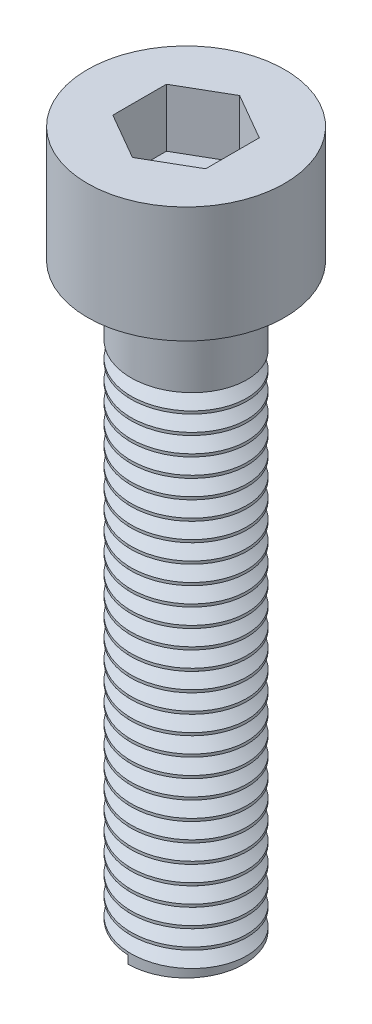
from build123d import *

# Parameters (mm, degrees)
SK_CABEZA_R         = 4.25
CABEZA_DEPTH        = 5
CANA_START          = -25
SK_CANA_R           = 2.5
CANA_DEPTH          = 25
HUECO_ALLEN_DEPTH   = 2.5
ROSCA_M5X0_8_PITCH  = 0.8
ROSCA_M5X0_8_HEIGHT = 22
ROSCA_M5X0_8_RADIUS = 2.5


with BuildPart() as part:
    # Sk_Cabeza → Cabeza (new body)
    with BuildSketch(Plane(origin=(0, 0, 0), x_dir=(1, 0, 0), z_dir=(0, 1, 0))):
        Circle(SK_CABEZA_R)
    extrude(amount=CABEZA_DEPTH)

    # Sk_Cana → Cana (add)
    with BuildSketch(Plane(origin=(0, 0, 0), x_dir=(1, 0, 0), z_dir=(0, 1, 0)).offset(CANA_START)):
        Circle(SK_CANA_R)
    extrude(amount=CANA_DEPTH)

    # Sk_Hueco_Allen → Hueco_Allen (cut)
    with BuildSketch(Plane(origin=(0, 5, 0), x_dir=(1, 0, 0), z_dir=(0, 1, 0))):
        Polygon((2, -1.154700538), (0, -2.309401077), (-2, -1.154700538), (-2, 1.154700538), (0, 2.309401077), (2, 1.154700538), align=None)
    extrude(amount=-HUECO_ALLEN_DEPTH, mode=Mode.SUBTRACT)

    # Rosca_M5x0,8: sweep along a helix
    with BuildLine() as rosca_m5x0_8_path:
        Helix(ROSCA_M5X0_8_PITCH, ROSCA_M5X0_8_HEIGHT, ROSCA_M5X0_8_RADIUS, center=(0, -25, 0), direction=(0, 1, 0), lefthand=True)
    # Sk_Perfil_rosca → Rosca_M5x0,8 (sweep, cut)
    with BuildSketch(Plane(origin=(0, 0, 0), x_dir=(0, 0, -1), z_dir=(1, 0, 0))):
        Polygon((-2.7, -25.48), (-2.00928, -25), (-2.7, -24.52), align=None)
    sweep(path=rosca_m5x0_8_path.line, is_frenet=True, mode=Mode.SUBTRACT)


solid = part.part
